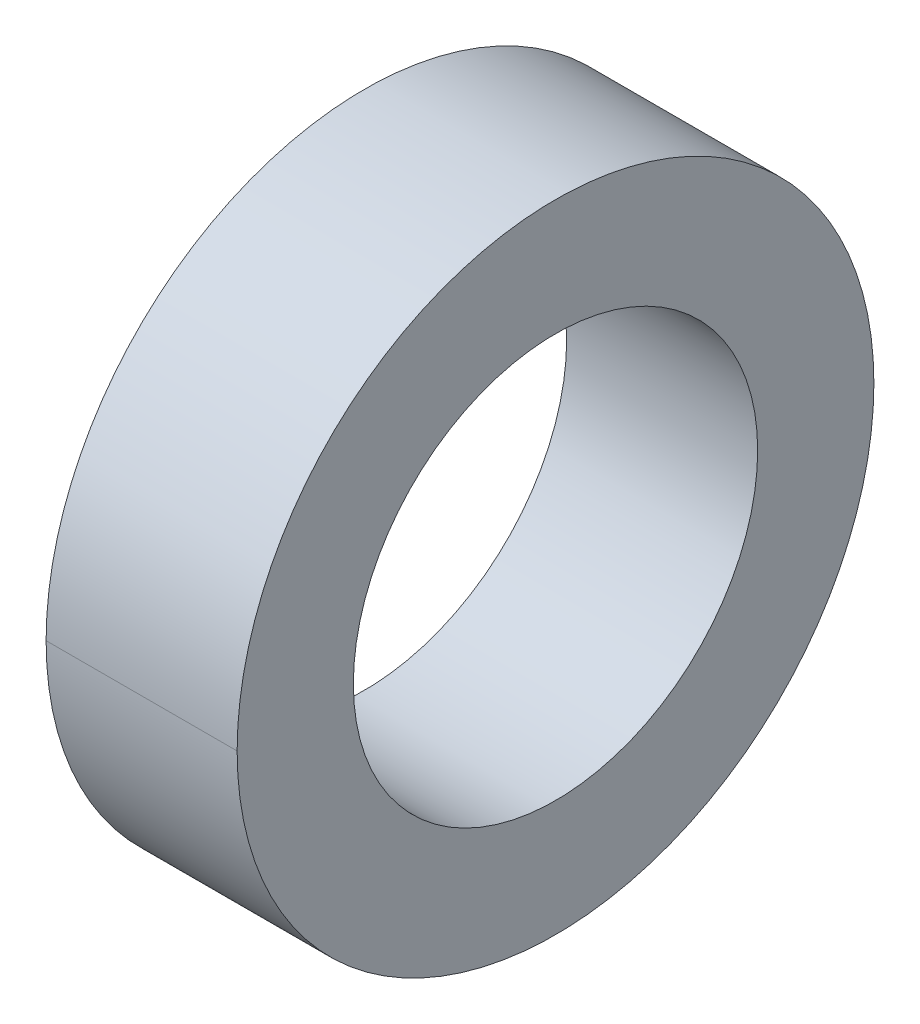
from build123d import *

# Parameters (mm, degrees)
SKETCH1_W           = 10
SKETCH1_H           = 10
BOSS_EXTRUDE1_DEPTH = 3
SKETCH2_R           = 3.175
CUT_EXTRUDE1_DEPTH  = 10
FILLET1_RADIUS      = 5
FILLET1_LENGTH      = 3
FILLET2_R           = 5


with BuildPart() as part:
    # Sketch1 → Boss-Extrude1 (new body)
    with BuildSketch(Plane(origin=(0, 0, 0), x_dir=(0, 0, -1), z_dir=(1, 0, 0))):
        Rectangle(SKETCH1_W, SKETCH1_H)
    extrude(amount=BOSS_EXTRUDE1_DEPTH)

    # Sketch2 → Cut-Extrude1 (cut)
    with BuildSketch(Plane.ZY):
        Circle(SKETCH2_R)
    extrude(amount=-CUT_EXTRUDE1_DEPTH, mode=Mode.SUBTRACT)

    # Fillet1: full round fillet: the end face becomes a half cylinder, R = half its width
    fillet1_face = Plane((1.5, 5, 0), x_dir=(1, 0, 0), z_dir=(0, 1, 0))  # on the end face: x along it, z out of the body
    fillet1_slab = fillet1_face.offset(-FILLET1_RADIUS / 2) * Box(FILLET1_LENGTH, 2 * FILLET1_RADIUS, FILLET1_RADIUS, mode=Mode.PRIVATE)  # the body's end, R deep
    fillet1_round = Plane((1.5, 0, 0), x_dir=(0, 1, 0), z_dir=(1, 0, 0)) * Cylinder(FILLET1_RADIUS, FILLET1_LENGTH, mode=Mode.PRIVATE)  # its axis R under the face
    add(fillet1_slab - fillet1_round, mode=Mode.SUBTRACT)

    # Fillet2
    fillet2_edges = [part.edges().sort_by_distance(p)[0] for p in [
        (1.5, -5, -5),
        (1.5, -5, 5),
    ]]
    fillet(fillet2_edges, radius=FILLET2_R - 0.0001)  # a hair under: the kernel refuses the full size


solid = part.part
